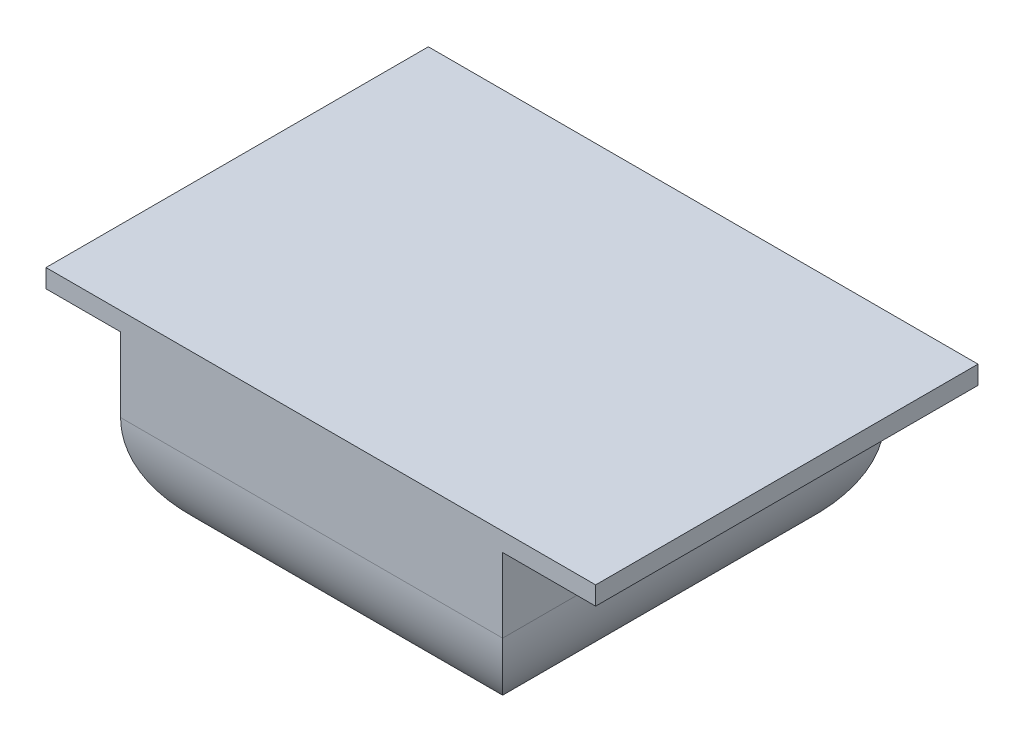
from build123d import *

# Parameters (mm, degrees)
SKETCH1_W           = 46
SKETCH1_H           = 22.468085106
BOSS_EXTRUDE1_DEPTH = 32
SKETCH2_OUTSIDE_W   = 60.074
SKETCH2_OUTSIDE_H   = 36.542
CUT_EXTRUDE3_DEPTH  = 42.611500526
FILLET1_R           = 10


with BuildPart() as part:
    # Sketch1 → Boss-Extrude1 (new body)
    with BuildSketch(Plane.XY):
        with Locations((1, -0.234042553)):
            Rectangle(SKETCH1_W, SKETCH1_H)
    extrude(amount=BOSS_EXTRUDE1_DEPTH)

    # Sketch2 outside → Cut-Extrude3 (cut, through all)
    with BuildSketch(Plane.XY):
        with Locations((1, -0.234)):
            Rectangle(SKETCH2_OUTSIDE_W, SKETCH2_OUTSIDE_H)
        Polygon((-22, 9.45700023), (-15.754846346, 9.45700023), (-15.754846346, -6.752570052), (16.218159255, -6.752570052), (16.218159255, 9.45700023), (24, 9.45700023), (24, 11), (-22, 11), align=None, mode=Mode.SUBTRACT)
    extrude(amount=CUT_EXTRUDE3_DEPTH, mode=Mode.SUBTRACT)

    # Fillet1
    fillet1_edges = [part.edges().sort_by_distance(p)[0] for p in [
        (0.231656455, -6.752570052, 0),
        (0.231656455, -6.752570052, 32),
        (16.218159255, -6.752570052, 16),
        (-15.754846346, -6.752570052, 16),
    ]]
    fillet(fillet1_edges, radius=FILLET1_R)


solid = part.part
